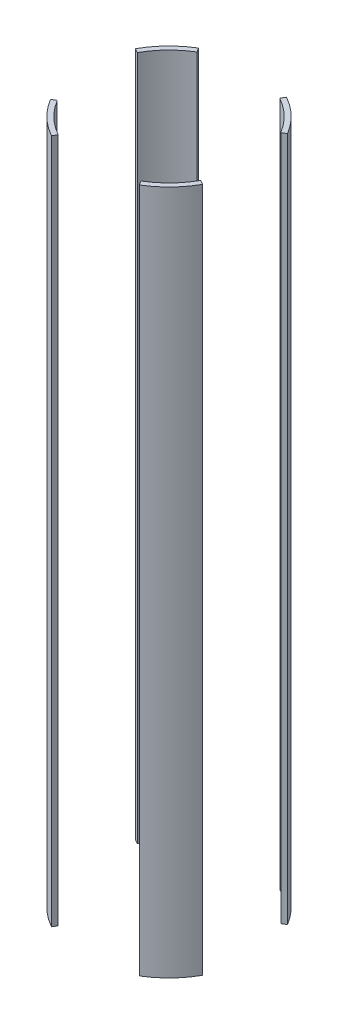
from build123d import *

# Parameters (mm, degrees)
SKETCH2_R               = 88.9
SKETCH2_R_2             = 83.82
BOSS_EXTRUDE1_DEPTH     = 352.425
CUT_EXTRUDE1_DEPTH      = 375.178835084
CUT_EXTRUDE1_DEPTH_BACK = 375.178835084


with BuildPart() as part:
    # Sketch2 → Boss-Extrude1 (new, symmetric)
    with BuildSketch(Plane(origin=(0, 0, 0), x_dir=(1, 0, 0), z_dir=(0, 1, 0))):
        Circle(SKETCH2_R)
        Circle(SKETCH2_R_2, mode=Mode.SUBTRACT)
    extrude(amount=BOSS_EXTRUDE1_DEPTH, both=True)

    # Sketch3 → Cut-Extrude1 (cut, two sides: drawn at the far end of the back side and taken through both)
    with BuildSketch(Plane(origin=(0, 0, 0), x_dir=(1, 0, 0), z_dir=(0, 1, 0)).offset(-CUT_EXTRUDE1_DEPTH_BACK)):
        Polygon((-58.116685864, 96.974944394), (0, 0), (53.900027233, 96.974944394), align=None)
        Polygon((70.991745134, -118.45858783), (0, 0), (-65.840936026, -118.45858783), align=None)
        Polygon((169.661755759, 101.677593364), (0, 0), (169.661755759, -94.300371224), align=None)
        Polygon((-123.741299607, -74.157652604), (0, 0), (-123.741299607, 68.777140945), align=None)
    extrude(amount=CUT_EXTRUDE1_DEPTH + CUT_EXTRUDE1_DEPTH_BACK, mode=Mode.SUBTRACT)


with BuildPart() as cut_extrude1_piece_1:
    # of the separate pieces the step leaves, piece 1, a body of its own (cut_extrude1_pieces)
    add(part.part.solids().sort_by_distance((-45.699187432, -352.425, -76.254798328))[0])


with BuildPart() as cut_extrude1_piece_2:
    # of the separate pieces the step leaves, piece 2, a body of its own (cut_extrude1_pieces)
    add(part.part.solids().sort_by_distance((45.699187432, -352.425, 76.254798328))[0])


with BuildPart() as cut_extrude1_piece_3:
    # of the separate pieces the step leaves, piece 3, a body of its own (cut_extrude1_pieces)
    add(part.part.solids().sort_by_distance((76.254798328, -352.425, -45.699187432))[0])


with BuildPart() as cut_extrude1_piece_4:
    # of the separate pieces the step leaves, piece 4, a body of its own (cut_extrude1_pieces)
    add(part.part.solids().sort_by_distance((-76.254798328, -352.425, 45.699187432))[0])


solid = Compound([cut_extrude1_piece_1.part, cut_extrude1_piece_2.part, cut_extrude1_piece_3.part, cut_extrude1_piece_4.part])
